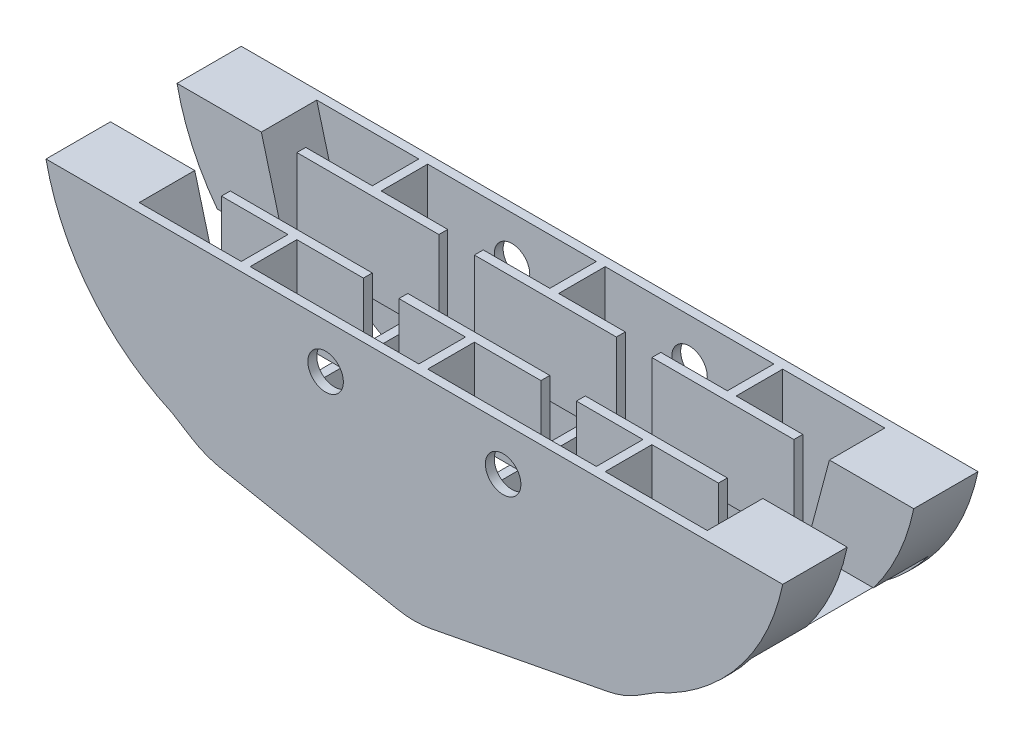
from build123d import *

# Parameters (mm, degrees)
BOSS_EXTRUDE1_DEPTH                 = 111.76
SKETCH5_W                           = 304.8
SKETCH5_H                           = 25.4
CUT_EXTRUDE3_DEPTH                  = 101.6
CUT_EXTRUDE4_DEPTH                  = 227.288199427
CUT_EXTRUDE4_DEPTH_BACK             = 227.288199427
SKETCH3_W                           = 96.52
SKETCH3_H                           = 101.6
SKETCH3_W_2                         = 48.26
CUT_EXTRUDE5_REACH                  = 288.663
SKETCH6_W                           = 38.1
SKETCH6_H                           = 50.8
SKETCH7_W                           = 81.28
SKETCH7_H                           = 50.8
BOSS_EXTRUDE2_DEPTH                 = 5.08
CUT_EXTRUDE6_REACH                  = 200.969
SKETCH8_R                           = 10.16
SKETCH9_W                           = 5.08
SKETCH9_H                           = 95.25
BOSS_EXTRUDE3_DEPTH                 = 10.16
SKETCH10_W                          = 5.08
SKETCH10_H                          = 95.206439839
BOSS_EXTRUDE4_DEPTH                 = 10.16
CUT_EXTRUDE7_REACH                  = 208.854
FILLET1_R                           = 50.8
BOSS_EXTRUDE5_REACH                 = 208.854
CUT_EXTRUDE8_REACH                  = 248.593
CUT_EXTRUDE8_END_RADIUS             = 126.32098656
CUT_EXTRUDE8_DIRECTION_2_REACH      = 248.593
CUT_EXTRUDE8_DIRECTION_2_END_RADIUS = 126.32098656


with BuildPart() as part:
    # Sketch1 → Boss-Extrude1 (new body)
    with BuildSketch(Plane.XY):
        Polygon((-152.4, 62.23), (-152.4, -33.02), (0, -62.23), (152.4, -32.976439839), (152.4, 62.23), align=None)
    extrude(amount=-BOSS_EXTRUDE1_DEPTH)

    # Sketch5 → Cut-Extrude3 (cut)
    with BuildSketch(Plane.XY.offset(-5.08)):
        with Locations((0, -1.27)):
            Rectangle(SKETCH5_W, SKETCH5_H)
    extrude(amount=-CUT_EXTRUDE3_DEPTH, mode=Mode.SUBTRACT)

    # Sketch3 → Cut-Extrude4 (cut, two sides: drawn at the far end of the back side and taken through both)
    with BuildSketch(Plane(origin=(0, 62.23, 0), x_dir=(1, 0, 0), z_dir=(0, 1, 0)).offset(-CUT_EXTRUDE4_DEPTH_BACK)):
        with Locations((-50.8, 55.88)):
            Rectangle(SKETCH3_W, SKETCH3_H)
        with Locations((50.8, 55.88)):
            Rectangle(SKETCH3_W, SKETCH3_H)
        with Locations((-128.27, 55.88)):
            Rectangle(SKETCH3_W_2, SKETCH3_H)
        with Locations((128.27, 55.88)):
            Rectangle(SKETCH3_W_2, SKETCH3_H)
    extrude(amount=CUT_EXTRUDE4_DEPTH + CUT_EXTRUDE4_DEPTH_BACK, mode=Mode.SUBTRACT)

    # Cut-Extrude5: up to this face of the body (flat: up to its plane)
    cut_extrude5_end = Plane(part.part.faces().sort_by_distance((104.14, 36.83, -55.88))[0])
    # Sketch6 → Cut-Extrude5 (cut, up to the picked face)
    with BuildSketch(Plane.ZY.offset(104.14), mode=Mode.PRIVATE) as cut_extrude5_sk1:
        with Locations((-55.932057734, 36.83)):
            Rectangle(SKETCH6_W, SKETCH6_H)
    cut_extrude5_tool1 = split(extrude(cut_extrude5_sk1.sketch, amount=-CUT_EXTRUDE5_REACH, mode=Mode.PRIVATE), bisect_by=cut_extrude5_end, keep=Keep.BOTH, mode=Mode.PRIVATE)
    add(cut_extrude5_tool1.solids().sort_by(Axis((-104.14, 36.83, -55.932058), (1, 0, 0)))[0], mode=Mode.SUBTRACT)

    # Sketch7 → Boss-Extrude2 (add)
    with BuildSketch(Plane(origin=(0, 0, -36.882057734), x_dir=(-1, 0, 0), z_dir=(0, 0, -1))):
        with Locations((0, 36.83)):
            Rectangle(SKETCH7_W, SKETCH7_H)
        with Locations((101.6, 36.83)):
            Rectangle(SKETCH7_W, SKETCH7_H)
        with Locations((-101.6, 36.83)):
            Rectangle(SKETCH7_W, SKETCH7_H)
    boss_extrude2 = extrude(amount=-BOSS_EXTRUDE2_DEPTH)

    # Mirror1: Boss-Extrude2 across plane
    add(boss_extrude2.mirror(Plane(origin=(0, 0, -55.932057734), x_dir=(1, 0, 0), z_dir=(0, 0, -1))))

    # Cut-Extrude6: up to this face of the body (flat: up to its plane)
    cut_extrude6_end = Plane(part.part.faces().sort_by_distance((-0.010072712, 6.983811852, -111.76))[0])
    # Sketch8 → Cut-Extrude6 (cut, up to the picked face)
    with BuildSketch(Plane.XY, mode=Mode.PRIVATE) as cut_extrude6_sk1:
        with Locations((50.8, 36.83)):
            Circle(SKETCH8_R)
    cut_extrude6_tool1 = split(extrude(cut_extrude6_sk1.sketch, amount=-CUT_EXTRUDE6_REACH, mode=Mode.PRIVATE), bisect_by=cut_extrude6_end, keep=Keep.BOTH, mode=Mode.PRIVATE)
    cut_extrude6 = cut_extrude6_tool1.solids().sort_by(Axis((50.8, 36.83, 0), (0, 0, -1)))[0]
    add(cut_extrude6, mode=Mode.SUBTRACT)

    # Mirror2: Cut-Extrude6 across plane
    add(cut_extrude6.mirror(Plane(origin=(0, 0, 0), x_dir=(0, 0, 1), z_dir=(1, 0, 0))), mode=Mode.SUBTRACT)

    # Sketch9 → Boss-Extrude3 (add)
    with BuildSketch(Plane.ZY.offset(152.4)):
        with Locations((-109.22, 14.605)):
            Rectangle(SKETCH9_W, SKETCH9_H)
        with Locations((-2.54, 14.605)):
            Rectangle(SKETCH9_W, SKETCH9_H)
    extrude(amount=BOSS_EXTRUDE3_DEPTH)

    # Sketch10 → Boss-Extrude4 (add)
    with BuildSketch(Plane(origin=(152.4, 0, 0), x_dir=(0, 0, -1), z_dir=(1, 0, 0))):
        with Locations((2.54, 14.626780081)):
            Rectangle(SKETCH10_W, SKETCH10_H)
        with Locations((109.22, 14.626780081)):
            Rectangle(SKETCH10_W, SKETCH10_H)
    extrude(amount=BOSS_EXTRUDE4_DEPTH)

    # Cut-Extrude7: up to this face of the body (flat: up to its plane)
    cut_extrude7_end = Plane(part.part.faces().sort_by_distance((-0.011704667, 6.851805545, -111.76))[0])
    # Sketch11 → Cut-Extrude7 (cut, up to the picked face)
    with BuildSketch(Plane.XY, mode=Mode.PRIVATE) as cut_extrude7_sk1:
        Polygon((-162.56, -12.7), (-119.696308585, -39.288207521), (-152.4, -33.02), (-162.56, -33.02), align=None)
    cut_extrude7_tool1 = split(extrude(cut_extrude7_sk1.sketch, amount=-CUT_EXTRUDE7_REACH, mode=Mode.PRIVATE), bisect_by=cut_extrude7_end, keep=Keep.BOTH, mode=Mode.PRIVATE)
    # Sketch11 → Cut-Extrude7 (cut, up to the picked face)
    with BuildSketch(Plane.XY, mode=Mode.PRIVATE) as cut_extrude7_sk2:
        Polygon((152.4, -33.02), (162.56, -33.02), (162.56, -12.7), (119.696308585, -39.288207521), align=None)
    cut_extrude7_tool2 = split(extrude(cut_extrude7_sk2.sketch, amount=-CUT_EXTRUDE7_REACH, mode=Mode.PRIVATE), bisect_by=cut_extrude7_end, keep=Keep.BOTH, mode=Mode.PRIVATE)
    add(cut_extrude7_tool1.solids().sort_by(Axis((-148.539263, -27.801749, 0), (0, 0, -1)))[0], mode=Mode.SUBTRACT)
    add(cut_extrude7_tool2.solids().sort_by(Axis((148.539263, -27.801749, 0), (0, 0, -1)))[0], mode=Mode.SUBTRACT)

    # Fillet1
    # the kernel refuses this fillet: 50.8 mm, written as the material it takes off along each edge
    with BuildSketch(Plane(origin=(-162.56, -12.7, 70.671047804), x_dir=(0.8497897447130388, -0.5271217978613181, 0), z_dir=(0, 0, -1)), Plane(origin=(-162.56, -12.7, -36.008952196), x_dir=(0.8497897447130388, -0.5271217978613181, 0), z_dir=(0, 0, -1)), Plane(origin=(162.56, -12.7, 70.671047804), x_dir=(0, 1, 0), z_dir=(0, 0, -1))) as fillet1_piece_1:
        with BuildLine():
            CenterArc((FILLET1_R * 0.556464943335, -FILLET1_R), FILLET1_R, 90, 58.188808221)
            Line((-FILLET1_R * 0.293324801378, -FILLET1_R * 0.472878202139), (0, 0))
            Line((0, 0), (FILLET1_R * 0.556464943335, 0))
        make_face()
    extrude(amount=146.422095607, mode=Mode.SUBTRACT)
    with BuildSketch(Plane(origin=(-119.696308585, -39.288207521, -83.186546401), x_dir=(0.9821230119270369, -0.18824024395268216, 0), z_dir=(0, 0, -1)), Plane(origin=(-119.696308585, -39.288207521, 23.493453599), x_dir=(0.9821230119270369, -0.18824024395268216, 0), z_dir=(0, 0, -1))) as fillet1_piece_2:
        with BuildLine():
            CenterArc((FILLET1_R * 0.184987823618, -FILLET1_R), FILLET1_R, 90, 20.961087149)
            Line((-FILLET1_R * 0.172745995297, -FILLET1_R * 0.0661764005955), (0, 0))
            Line((0, 0), (FILLET1_R * 0.184987823618, 0))
        make_face()
    extrude(amount=52.066907199, mode=Mode.SUBTRACT)
    with BuildSketch(Plane(origin=(162.56, -12.7, -36.008952196), x_dir=(-0.8497897447130388, -0.5271217978613181, 0), z_dir=(0, 0, -1))) as fillet1_piece_3:
        with BuildLine():
            CenterArc((FILLET1_R * 0.556464943335, FILLET1_R), FILLET1_R, 211.811191779, 58.188808221)
            Line((-FILLET1_R * 0.293324801378, FILLET1_R * 0.472878202139), (0, 0))
            Line((0, 0), (FILLET1_R * 0.556464943335, 0))
        make_face()
    extrude(amount=146.422095607, mode=Mode.SUBTRACT)
    with BuildSketch(Plane(origin=(119.776180176, -39.238663434, 23.475348992), x_dir=(-0.9820710795721669, -0.18851099349363817, 0), z_dir=(0, 0, -1)), Plane(origin=(119.776180176, -39.238663434, -83.204651008), x_dir=(-0.9820710795721669, -0.18851099349363817, 0), z_dir=(0, 0, -1))) as fillet1_piece_4:
        with BuildLine():
            CenterArc((FILLET1_R * 0.184845267653, FILLET1_R), FILLET1_R, 249.054708445, 20.945291555)
            Line((-FILLET1_R * 0.172631096402, FILLET1_R * 0.0660778141933), (0, 0))
            Line((0, 0), (FILLET1_R * 0.184845267653, 0))
        make_face()
    extrude(amount=52.030697984, mode=Mode.SUBTRACT)
    with BuildSketch(Plane(origin=(0, -62.23, 24.359816254), x_dir=(-0.982123011927037, 0.1882402439526816, 0), z_dir=(0, 0, -1))) as fillet1_piece_5:
        with BuildLine():
            CenterArc((FILLET1_R * 0.191809576801, FILLET1_R), FILLET1_R, 248.283995147, 21.716004853)
            Line((-FILLET1_R * 0.178196707507, FILLET1_R * 0.0709707488072), (0, 0))
            Line((0, 0), (FILLET1_R * 0.191809576801, 0))
        make_face()
    extrude(amount=160.479632508, mode=Mode.SUBTRACT)

    # Boss-Extrude5: up to this face of the body (flat: up to its plane)
    boss_extrude5_end = Plane(part.part.faces().sort_by_distance((-0.004823682, 7.831331811, -111.76))[0])
    # Sketch12 → Boss-Extrude5 (add, up to the picked face)
    with BuildSketch(Plane.XY, mode=Mode.PRIVATE) as boss_extrude5_sk1:
        with BuildLine():
            Line((-162.56, 62.23), (-210.82, 62.23))
            ThreePointArc((-210.82, 62.23), (-185.525923559, 8.586514121), (-138.537787331, -27.60089991))
            Line((-138.537787331, -27.60089991), (-162.56, 62.23))
        make_face()
    boss_extrude5_tool1 = split(extrude(boss_extrude5_sk1.sketch, amount=-BOSS_EXTRUDE5_REACH, mode=Mode.PRIVATE), bisect_by=boss_extrude5_end, keep=Keep.BOTH, mode=Mode.PRIVATE)
    # Sketch12 → Boss-Extrude5 (add, up to the picked face)
    with BuildSketch(Plane.XY, mode=Mode.PRIVATE) as boss_extrude5_sk2:
        with BuildLine():
            Line((162.56, 62.23), (210.82, 62.23))
            ThreePointArc((210.82, 62.23), (185.525923559, 8.586514121), (138.537787331, -27.60089991))
            Line((138.537787331, -27.60089991), (162.56, 62.23))
        make_face()
    boss_extrude5_tool2 = split(extrude(boss_extrude5_sk2.sketch, amount=-BOSS_EXTRUDE5_REACH, mode=Mode.PRIVATE), bisect_by=boss_extrude5_end, keep=Keep.BOTH, mode=Mode.PRIVATE)
    add(boss_extrude5_tool1.solids().sort_by(Axis((-173.436994, 26.131053, 0), (0, 0, -1)))[0])
    add(boss_extrude5_tool2.solids().sort_by(Axis((173.436994, 26.131053, 0), (0, 0, -1)))[0])

    # Cut-Extrude8: up to this cylinder (the profile starts inside it)
    cut_extrude8_end = Plane(origin=(-87.109319049, 87.777192878, -55.90231), z_dir=(0, 0, 1)) * Cylinder(CUT_EXTRUDE8_END_RADIUS, 750.827973119, mode=Mode.PRIVATE)
    # Sketch13 → Cut-Extrude8 (cut, up to the surface)
    with BuildSketch(Plane(origin=(0, 0, 0), x_dir=(0, 0, -1), z_dir=(1, 0, 0)), mode=Mode.PRIVATE) as cut_extrude8_sk1:
        Polygon((36.882057734, 62.23), (36.882057734, 11.43), (5.08, 11.43), (5.08, -13.97), (106.68, -13.97), (106.68, 11.43), (74.982057734, 11.43), (74.982057734, 62.23), align=None)
    cut_extrude8_tool1 = extrude(cut_extrude8_sk1.sketch, amount=-CUT_EXTRUDE8_REACH, mode=Mode.PRIVATE) & cut_extrude8_end
    add(cut_extrude8_tool1.solids().sort_by_distance((0, 15.058571, -55.90231))[0], mode=Mode.SUBTRACT)

    # Cut-Extrude8 direction 2: up to this cylinder (the profile starts inside it)
    cut_extrude8_direction_2_end = Plane(origin=(87.109319049, 87.777192878, -55.90231), z_dir=(0, 0, 1)) * Cylinder(CUT_EXTRUDE8_DIRECTION_2_END_RADIUS, 750.827973119, mode=Mode.PRIVATE)
    # Sketch13 → Cut-Extrude8 direction 2 (cut, up to the surface)
    with BuildSketch(Plane(origin=(0, 0, 0), x_dir=(0, 0, -1), z_dir=(1, 0, 0)), mode=Mode.PRIVATE) as cut_extrude8_direction_2_sk1:
        Polygon((36.882057734, 62.23), (36.882057734, 11.43), (5.08, 11.43), (5.08, -13.97), (106.68, -13.97), (106.68, 11.43), (74.982057734, 11.43), (74.982057734, 62.23), align=None)
    cut_extrude8_direction_2_tool1 = extrude(cut_extrude8_direction_2_sk1.sketch, amount=CUT_EXTRUDE8_DIRECTION_2_REACH, mode=Mode.PRIVATE) & cut_extrude8_direction_2_end
    add(cut_extrude8_direction_2_tool1.solids().sort_by_distance((0, 15.058571, -55.90231))[0], mode=Mode.SUBTRACT)


solid = part.part
